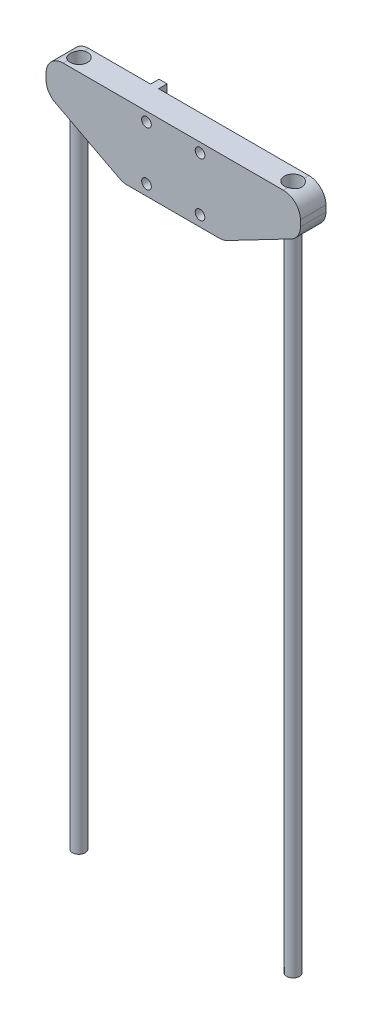
from build123d import *

# Parameters (mm, degrees)
BOSS_EXTRUDE1_DEPTH            = 4.7625
CUT_EXTRUDE1_DEPTH             = 10
SKETCH4_W                      = 2.38125
SKETCH4_H                      = 243.6
SKETCH4_3_W                    = 2.38125
SKETCH4_3_H                    = 243.6
SKETCH6_W                      = 1.8
SKETCH6_H                      = 9.525
M3_CLEARANCE_HOLE1_AT_2_COUNT  = 2
M3_CLEARANCE_HOLE1_AT_2_PITCH  = 20
M3_CLEARANCE_HOLE1_AT_3_COUNT  = 2
M3_CLEARANCE_HOLE1_AT_3_PITCH  = 28.284271247
M3_CLEARANCE_HOLE1_AT_4_COUNT  = 2
M3_CLEARANCE_HOLE1_AT_4_PITCH  = 20
CBORE_FOR_M3_SHCS2_AT_2_COUNT  = 2
CBORE_FOR_M3_SHCS2_AT_2_PITCH  = 80
M3X0_5_TAPPED_HOLE1_AT_2_COUNT = 2
M3X0_5_TAPPED_HOLE1_AT_2_PITCH = 80
FILLET1_R                      = 6.35
SKETCH16_W                     = 3
SKETCH16_H                     = 24.5
BOSS_EXTRUDE2_DEPTH            = 3.175


with BuildPart() as part:
    # Sketch3 → Boss-Extrude1 (new, symmetric)
    with BuildSketch(Plane.XY):
        Polygon((-47.5, 12.5), (-47.5, 0), (-18.75, -15), (18.75, -15), (47.5, 0), (47.5, 12.5), align=None)
    extrude(amount=BOSS_EXTRUDE1_DEPTH, both=True)

    # Sketch10 → Cut-Extrude1 (cut)
    with BuildSketch(Plane(origin=(0, 0, 0), x_dir=(1, 0, 0), z_dir=(0, 1, 0))):
        with BuildLine():
            Line((40, 2.38125), (35, 2.38125))
            ThreePointArc((35, 2.38125), (32.61875, 0), (35, -2.38125))
            Line((35, -2.38125), (40, -2.38125))
            ThreePointArc((40, -2.38125), (42.38125, 0), (40, 2.38125))
        make_face()
        with BuildLine():
            Line((-40, 2.38125), (-35, 2.38125))
            ThreePointArc((-35, 2.38125), (-32.61875, 0), (-35, -2.38125))
            Line((-35, -2.38125), (-40, -2.38125))
            ThreePointArc((-40, -2.38125), (-42.38125, 0), (-40, 2.38125))
        make_face()
    extrude(amount=-CUT_EXTRUDE1_DEPTH, mode=Mode.SUBTRACT)

    # Sketch6 → M3 Clearance Hole1 (revolve, cut)
    with BuildSketch(Plane(origin=(-10, 9, 4.7625), x_dir=(0, -1, 0), z_dir=(1, 0, 0))):
        with Locations((0.9, 4.7625)):
            Rectangle(SKETCH6_W, SKETCH6_H)
    m3_clearance_hole1 = revolve(axis=Axis((-10, 9, 11.1125), (0, 0, -1)), mode=Mode.SUBTRACT)

    # M3 Clearance Hole1 at 2: M3 Clearance Hole1 ×2
    with Locations(*[(0, -i * M3_CLEARANCE_HOLE1_AT_2_PITCH, 0) for i in range(1, M3_CLEARANCE_HOLE1_AT_2_COUNT)]):
        add(m3_clearance_hole1, mode=Mode.SUBTRACT)

    # M3 Clearance Hole1 at 3: M3 Clearance Hole1 ×2
    with Locations(*[Vector(0.707106781186549, -0.707106781186546, 0) * (i * M3_CLEARANCE_HOLE1_AT_3_PITCH) for i in range(1, M3_CLEARANCE_HOLE1_AT_3_COUNT)]):
        add(m3_clearance_hole1, mode=Mode.SUBTRACT)

    # M3 Clearance Hole1 at 4: M3 Clearance Hole1 ×2
    with Locations(*[(i * M3_CLEARANCE_HOLE1_AT_4_PITCH, 0, 0) for i in range(1, M3_CLEARANCE_HOLE1_AT_4_COUNT)]):
        add(m3_clearance_hole1, mode=Mode.SUBTRACT)

    # Sketch12 → CBORE for M3 SHCS2 (revolve, cut)
    with BuildSketch(Plane(origin=(-40, 12.5, 0), x_dir=(0, 0, 1), z_dir=(1, 0, 0))):
        Polygon((0, 0), (0, 256.1), (1.8, 256.1), (1.8, 9.5), (3.25, 9.5), (3.25, 0), align=None)
    cbore_for_m3_shcs2 = revolve(axis=Axis((-40, 18.85, 0), (0, -1, 0)), mode=Mode.SUBTRACT)

    # CBORE for M3 SHCS2 at 2: CBORE for M3 SHCS2 ×2
    with Locations(*[(i * CBORE_FOR_M3_SHCS2_AT_2_PITCH, 0, 0) for i in range(1, CBORE_FOR_M3_SHCS2_AT_2_COUNT)]):
        add(cbore_for_m3_shcs2, mode=Mode.SUBTRACT)

    # Fillet1
    # the kernel refuses this fillet: 6.35 mm, written as the material it takes off along each edge
    with BuildSketch(Plane(origin=(47.5, 12.5, 20.6375), x_dir=(-1, 0, 0), z_dir=(0, 0, -1)), Plane(origin=(-47.5, 12.5, 20.6375), x_dir=(0, -1, 0), z_dir=(0, 0, -1))) as fillet1_piece_1:
        with BuildLine():
            CenterArc((FILLET1_R, -FILLET1_R), FILLET1_R, 90, 90)
            Line((0, -FILLET1_R), (0, 0))
            Line((0, 0), (FILLET1_R, 0))
        make_face()
    extrude(amount=41.275, mode=Mode.SUBTRACT)
    with BuildSketch(Plane(origin=(47.5, 0, 14.385678967), x_dir=(0, 1, 0), z_dir=(0, 0, -1)), Plane(origin=(-47.5, 0, -14.385678967), x_dir=(0, 1, 0), z_dir=(0, 0, 1))) as fillet1_piece_2:
        with BuildLine():
            CenterArc((FILLET1_R * 0.606184501832, -FILLET1_R), FILLET1_R, 90, 62.447188423)
            Line((-FILLET1_R * 0.280400344333, -FILLET1_R * 0.537433993305), (0, 0))
            Line((0, 0), (FILLET1_R * 0.606184501832, 0))
        make_face()
    extrude(amount=28.771357933, mode=Mode.SUBTRACT)
    with BuildSketch(Plane(origin=(18.75, -15, -8.654843019), x_dir=(-1, 0, 0), z_dir=(0, 0, 1)), Plane(origin=(-18.75, -15, -8.654843019), x_dir=(-0.8865848461654543, 0.4625660066950205, 0), z_dir=(0, 0, 1))) as fillet1_piece_3:
        with BuildLine():
            CenterArc((FILLET1_R * 0.245186961845, -FILLET1_R), FILLET1_R, 90, 27.552811577)
            Line((-FILLET1_R * 0.21737904485, -FILLET1_R * 0.113415153835), (0, 0))
            Line((0, 0), (FILLET1_R * 0.245186961845, 0))
        make_face()
    extrude(amount=17.309686039, mode=Mode.SUBTRACT)

    # Sketch16 → Boss-Extrude2 (add)
    with BuildSketch(Plane(origin=(0, 0, -4.7625), x_dir=(-1, 0, 0), z_dir=(0, 0, -1))):
        with Locations((16.5, 0.25)):
            Rectangle(SKETCH16_W, SKETCH16_H)
    extrude(amount=BOSS_EXTRUDE2_DEPTH)


with BuildPart() as body_2:
    # Sketch4 → Revolve1 (revolve)
    with BuildSketch(Plane.XY):
        with Locations((-41.190625, -121.8)):
            Rectangle(SKETCH4_W, SKETCH4_H)
    revolve(axis=Axis((-40, -243.6, 0), (0, -1, 0)))

    # Sketch14 → M3x0.5 Tapped Hole1 (revolve, cut)
    with BuildSketch(Plane(origin=(-40, 0, 0), x_dir=(0, 0, 1), z_dir=(1, 0, 0))):
        Polygon((0, 0), (0, 8.251075774), (1.25, 7.5), (1.25, 0), align=None)
    m3x0_5_tapped_hole1 = revolve(axis=Axis((-40, 6.35, 0), (0, -1, 0)), mode=Mode.SUBTRACT)


with BuildPart() as body_3:
    # Sketch4<3> → Revolve2 (revolve)
    with BuildSketch(Plane.XY):
        with Locations((38.809375, -121.8)):
            Rectangle(SKETCH4_3_W, SKETCH4_3_H)
    revolve(axis=Axis((40, -243.6, 0), (0, -1, 0)))

    # M3x0.5 Tapped Hole1 at 2: M3x0.5 Tapped Hole1 ×2
    with Locations(*[(i * M3X0_5_TAPPED_HOLE1_AT_2_PITCH, 0, 0) for i in range(1, M3X0_5_TAPPED_HOLE1_AT_2_COUNT)]):
        add(m3x0_5_tapped_hole1, mode=Mode.SUBTRACT)


solid = Compound([part.part, body_2.part, body_3.part])
